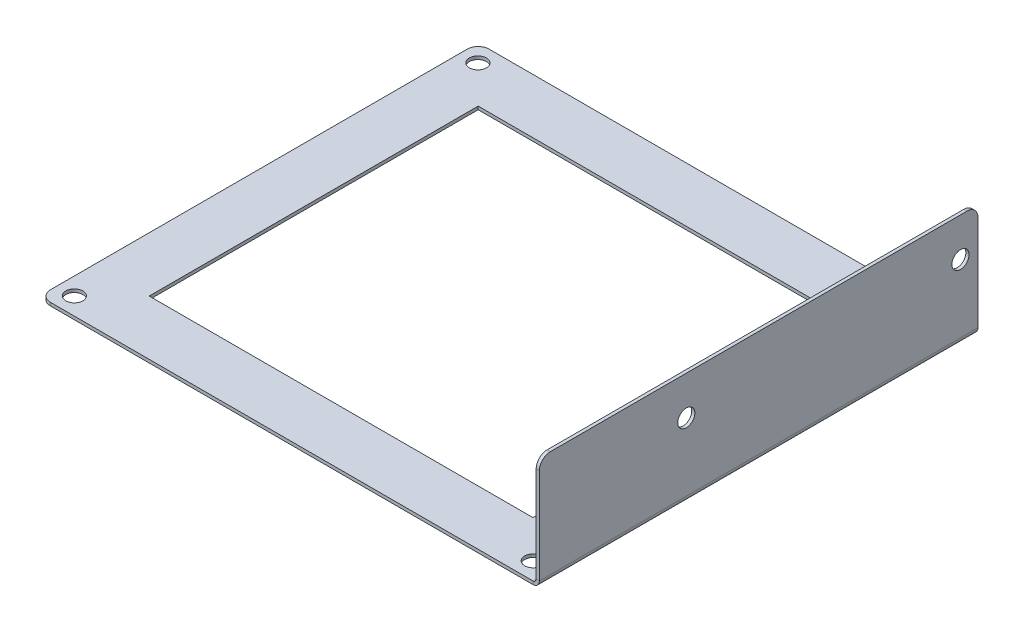
from build123d import *

# Parameters (mm, degrees)
SKETCH1_W                       = 114.3
SKETCH1_H                       = 101.6
BASE_FLANGE2_DEPTH              = 0.7366
EDGE_FLANGE1_DEPTH              = 101.6
F_5_32_0_15625_DIAMETER_HOLE1_D = 3.96875
F_5_32_0_15625_DIAMETER_HOLE2_D = 3.96875
SKETCH13_W                      = 88.9
SKETCH13_H                      = 76.2
CUT_EXTRUDE1_DEPTH              = 156.02325632
BREAK_CORNER1_START             = 0.7366
BREAK_CORNER1_DEPTH             = 0.7366
BREAK_CORNER1_START_2           = -0.7366
BREAK_CORNER1_2_DEPTH           = 0.7366


# Read off the part's stored shape, not the designer's step: Break-Corner1
# Sheet-metal steps are written as plain solids
with BuildPart() as part:
    # Sketch1 → Base-Flange2 (new body)
    with BuildSketch(Plane(origin=(0, 0, 0), x_dir=(1, 0, 0), z_dir=(0, 1, 0))):
        with Locations((-57.15, 50.8)):
            Rectangle(SKETCH1_W, SKETCH1_H)
    extrude(amount=-BASE_FLANGE2_DEPTH)

    # Edge-Flange1 section (across the edge) → Edge-Flange1 (add)
    with BuildSketch(Plane(origin=(0.7366, 0, 0), x_dir=(-1, 0, 0), z_dir=(0, 0, -1))):
        with BuildLine():
            Line((-0.7366, 0.7366), (-0.7366, 25.4))
            Line((-0.7366, 25.4), (0, 25.4))
            Line((0, 25.4), (0, 0.7366))
            ThreePointArc((0, 0.7366), (0.215745145, 0.215745145), (0.7366, 0))
            Line((0.7366, 0), (0.7366, -0.7366))
            ThreePointArc((0.7366, -0.7366), (-0.30510971, -0.30510971), (-0.7366, 0.7366))
        make_face()
    extrude(amount=EDGE_FLANGE1_DEPTH)

    # 5/32 (0.15625) Diameter Hole1 (through all)
    with Locations(Plane(origin=(0, 0, 0), x_dir=(1, 0, 0), z_dir=(0, 1, 0))):
        with Locations((-110.2995, 4.064), (-110.2995, 97.536), (-4.0005, 97.536), (-4.0005, 4.064)):
            Hole(F_5_32_0_15625_DIAMETER_HOLE1_D / 2)

    # 5/32 (0.15625) Diameter Hole2 (through all)
    with Locations(Plane.ZY.offset(-0.7366)):
        with Locations((-34.036, 16.436061869), (-97.536, 16.436061869)):
            Hole(F_5_32_0_15625_DIAMETER_HOLE2_D / 2)

    # Sketch13 → Cut-Extrude1 (cut, through all)
    with BuildSketch(Plane(origin=(0, 0, 0), x_dir=(1, 0, 0), z_dir=(0, 1, 0))):
        with Locations((-57.15, 50.8)):
            Rectangle(SKETCH13_W, SKETCH13_H)
    extrude(amount=-CUT_EXTRUDE1_DEPTH, mode=Mode.SUBTRACT)

    # Break-Corner1 outline → Break-Corner1 (cut)
    with BuildSketch(Plane.YZ.offset(BREAK_CORNER1_START)):
        with BuildLine():
            Line((25.4, 0), (22.86, 0))
            ThreePointArc((22.86, 0), (24.656051224, -0.743948776), (25.4, -2.54))
            Line((25.4, -2.54), (25.4, 0))
        make_face()
        with BuildLine():
            Line((25.4, -101.6), (25.4, -99.06))
            ThreePointArc((25.4, -99.06), (24.656051224, -100.856051224), (22.86, -101.6))
            Line((22.86, -101.6), (25.4, -101.6))
        make_face()
    extrude(amount=BREAK_CORNER1_DEPTH, mode=Mode.SUBTRACT)

    # Break-Corner1 2 outline → Break-Corner1 2 (cut)
    with BuildSketch(Plane(origin=(0, 0, 0), x_dir=(1, 0, 0), z_dir=(0, 1, 0)).offset(BREAK_CORNER1_START_2)):
        with BuildLine():
            Line((-114.3, 101.6), (-114.3, 99.06))
            ThreePointArc((-114.3, 99.06), (-113.556051224, 100.856051224), (-111.76, 101.6))
            Line((-111.76, 101.6), (-114.3, 101.6))
        make_face()
        with BuildLine():
            ThreePointArc((-111.76, 0), (-113.556051224, 0.743948776), (-114.3, 2.54))
            Line((-114.3, 2.54), (-114.3, 0))
            Line((-114.3, 0), (-111.76, 0))
        make_face()
    extrude(amount=BREAK_CORNER1_2_DEPTH, mode=Mode.SUBTRACT)


solid = part.part
